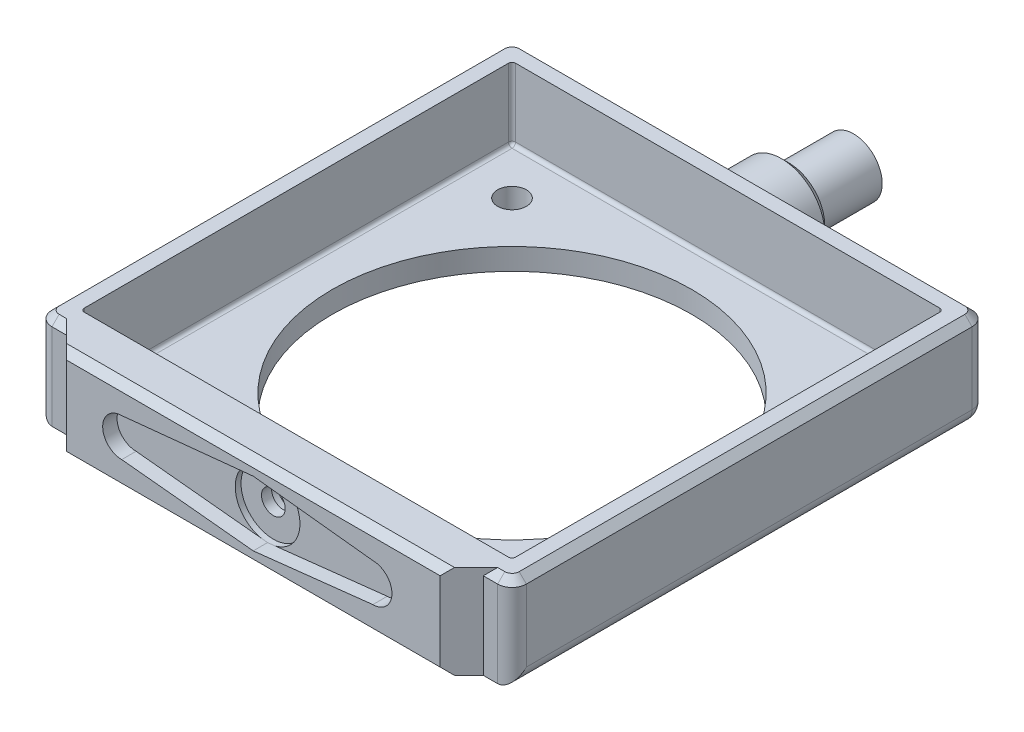
from build123d import *

# Parameters (mm, degrees)
SKETCH1_W                = 66
SKETCH1_H                = 66
SKETCH1_W_2              = 60
SKETCH1_H_2              = 60
BOSS_EXTRUDE1_DEPTH      = 13
SKETCH2_W                = 60
SKETCH2_H                = 60
SKETCH2_R                = 25
SKETCH2_R_2              = 2
BOSS_EXTRUDE2_DEPTH      = 3
FILLET1_R                = 0.5
FILLET2_R                = 2
SKETCH12_W               = 52
SKETCH12_H               = 11
BOSS_EXTRUDE3_DEPTH      = 3
CHAMFER1_SIZE            = 3
CUT_EXTRUDE4_DEPTH       = 12
CUT_EXTRUDE4_DEPTH_BACK  = 12
SKETCH10_R               = 1.65
SKETCH13_R               = 3.05
CUT_EXTRUDE6_DEPTH       = 1.8
SKETCH14_R               = 4
BOSS_EXTRUDE4_DEPTH      = 14.5
BOSS_EXTRUDE5_DEPTH      = 5.5
BOSS_EXTRUDE5_DEPTH_BACK = 2
SKETCH15_R               = 6
CHAMFER2_SIZE            = 1
CHAMFER3_SIZE            = 1
SKETCH17_R               = 2.65
SKETCH17_R_2             = 1.65
CUT_EXTRUDE8_DEPTH       = 2
SKETCH18_R               = 4.5
CUT_EXTRUDE9_DEPTH       = 0.8


with BuildPart() as part:
    # Sketch1 → Boss-Extrude1 (new body)
    with BuildSketch(Plane(origin=(0, 0, 0), x_dir=(1, 0, 0), z_dir=(0, 1, 0))):
        Rectangle(SKETCH1_W, SKETCH1_H)
        Rectangle(SKETCH1_W_2, SKETCH1_H_2, mode=Mode.SUBTRACT)
    extrude(amount=BOSS_EXTRUDE1_DEPTH)

    # Sketch2 → Boss-Extrude2 (add)
    with BuildSketch(Plane(origin=(0, 0, 0), x_dir=(1, 0, 0), z_dir=(0, 1, 0))):
        Rectangle(SKETCH2_W, SKETCH2_H)
        with Locations(Location((0, 0, 0), (0, 0, 270))):
            Circle(SKETCH2_R, mode=Mode.SUBTRACT)
        with Locations(Location((-23.5, 23.5, 0), (0, 0, 270))):
            Circle(SKETCH2_R_2, mode=Mode.SUBTRACT)
        with Locations(Location((23.5, 23.5, 0), (0, 0, 270))):
            Circle(SKETCH2_R_2, mode=Mode.SUBTRACT)
        with Locations(Location((23.5, -23.5, 0), (0, 0, 270))):
            Circle(SKETCH2_R_2, mode=Mode.SUBTRACT)
        with Locations(Location((-23.5, -23.5, 0), (0, 0, 270))):
            Circle(SKETCH2_R_2, mode=Mode.SUBTRACT)
    extrude(amount=BOSS_EXTRUDE2_DEPTH)

    # Fillet1
    fillet1_edges = [part.edges().sort_by_distance(p)[0] for p in [
        (-30, 8, -30),
        (-30, 8, 30),
        (30, 8, 30),
        (30, 8, -30),
        (-30, 3, 0),
        (0, 3, 30),
        (30, 3, 0),
        (0, 3, -30),
    ]]
    fillet(fillet1_edges, radius=FILLET1_R)

    # Fillet2
    fillet2_edges = [part.edges().sort_by_distance(p)[0] for p in [
        (0, 0, -33),
        (33, 0, 0),
        (-33, 0, 0),
        (-33, 6.5, -33),
        (33, 6.5, -33),
        (33, 6.5, 33),
        (-33, 6.5, 33),
    ]]
    fillet(fillet2_edges, radius=FILLET2_R)

    # Sketch12 → Boss-Extrude3 (add)
    with BuildSketch(Plane.XY.offset(33)):
        with Locations((0, 6.5)):
            Rectangle(SKETCH12_W, SKETCH12_H)
    extrude(amount=BOSS_EXTRUDE3_DEPTH)

    # Chamfer1
    # the kernel refuses this chamfer: 3 mm, written as the material it adds along each edge
    with BuildSketch(Plane(origin=(26, 1, 33), x_dir=(0, -0.9996219169112968, -0.027495876610586775), z_dir=(-1, 0, 0))) as chamfer1_piece_1_section:
        Polygon((CHAMFER1_SIZE * 0.999621916911, CHAMFER1_SIZE * 0.0274958766106), (-CHAMFER1_SIZE * 0.0274958766106, CHAMFER1_SIZE * 0.999621916911), (0, 0), align=None)
    chamfer1_piece_1 = extrude(amount=52, mode=Mode.PRIVATE)
    chamfer1_piece_1 = split(chamfer1_piece_1, bisect_by=Plane(origin=(0, 0, 34.280814641), z_dir=(0, 1, 0)), keep=Keep.TOP, mode=Mode.PRIVATE)
    chamfer1_piece_1 = split(chamfer1_piece_1, bisect_by=Plane(origin=(0, 0.572987798, 36), z_dir=(0, 0, -1)), keep=Keep.TOP, mode=Mode.PRIVATE)
    add(chamfer1_piece_1)
    with BuildSketch(Plane(origin=(26, 12, 33), x_dir=(0.9996219169112965, 0, -0.02749587661058676), z_dir=(0, -1, 0))) as chamfer1_piece_2_section:
        Polygon((CHAMFER1_SIZE * 0.999621916911, CHAMFER1_SIZE * 0.0274958766106), (-CHAMFER1_SIZE * 0.0274958766106, CHAMFER1_SIZE * 0.999621916911), (0, 0), align=None)
    chamfer1_piece_2 = extrude(amount=11, mode=Mode.PRIVATE)
    chamfer1_piece_2 = split(chamfer1_piece_2, bisect_by=Plane(origin=(26.991212463, 6.5, 36), z_dir=(0, 0, -1)), keep=Keep.TOP, mode=Mode.PRIVATE)
    add(chamfer1_piece_2)
    with BuildSketch(Plane(origin=(-26, 12, 33), x_dir=(0, 0.9996219169112968, -0.02749587661058678), z_dir=(1, 0, 0))) as chamfer1_piece_3_section:
        Polygon((CHAMFER1_SIZE * 0.999621916911, CHAMFER1_SIZE * 0.0274958766106), (-CHAMFER1_SIZE * 0.0274958766106, CHAMFER1_SIZE * 0.999621916911), (0, 0), align=None)
    chamfer1_piece_3 = extrude(amount=52, mode=Mode.PRIVATE)
    chamfer1_piece_3 = split(chamfer1_piece_3, bisect_by=Plane(origin=(0, 13, 34.280814641), z_dir=(0, -1, 0)), keep=Keep.TOP, mode=Mode.PRIVATE)
    chamfer1_piece_3 = split(chamfer1_piece_3, bisect_by=Plane(origin=(0, 12.427012202, 36), z_dir=(0, 0, -1)), keep=Keep.TOP, mode=Mode.PRIVATE)
    add(chamfer1_piece_3)
    with BuildSketch(Plane(origin=(-26, 1, 33), x_dir=(-0.9996219169112965, 0, -0.02749587661058676), z_dir=(0, 1, 0))) as chamfer1_piece_4_section:
        Polygon((CHAMFER1_SIZE * 0.999621916911, CHAMFER1_SIZE * 0.0274958766106), (-CHAMFER1_SIZE * 0.0274958766106, CHAMFER1_SIZE * 0.999621916911), (0, 0), align=None)
    chamfer1_piece_4 = extrude(amount=11, mode=Mode.PRIVATE)
    chamfer1_piece_4 = split(chamfer1_piece_4, bisect_by=Plane(origin=(-26.991212463, 6.5, 36), z_dir=(0, 0, -1)), keep=Keep.TOP, mode=Mode.PRIVATE)
    add(chamfer1_piece_4)
    with BuildSketch(Plane(origin=(26, 12, 33), x_dir=(0.9996219169112965, 0, -0.02749587661058676), z_dir=(0, -1, 0))) as chamfer1_piece_5a_section:
        Polygon((CHAMFER1_SIZE * 0.999621916911, CHAMFER1_SIZE * 0.0274958766106), (-CHAMFER1_SIZE * 0.0274958766106, CHAMFER1_SIZE * 0.999621916911), (0, 0), align=None)
    chamfer1_piece_5a = extrude(amount=18.715048964, mode=Mode.PRIVATE)
    chamfer1_piece_5a = split(chamfer1_piece_5a, bisect_by=Plane(origin=(26.991212463, 0, 33.985903001), z_dir=(0, 1, 0)), keep=Keep.TOP, mode=Mode.PRIVATE)
    chamfer1_piece_5a = split(chamfer1_piece_5a, bisect_by=Plane(origin=(26.991212463, 1, 33.985903001), z_dir=(0, -1, 0)), keep=Keep.TOP, mode=Mode.PRIVATE)
    chamfer1_piece_5a = split(chamfer1_piece_5a, bisect_by=Plane(origin=(26.991212463, 0.5, 36), z_dir=(0, 0, -1)), keep=Keep.TOP, mode=Mode.PRIVATE)
    with BuildSketch(Plane(origin=(33.715048964, 1, 33), x_dir=(0, -0.9996219169112968, -0.027495876610586775), z_dir=(-1, 0, 0))) as chamfer1_piece_5b_section:
        Polygon((CHAMFER1_SIZE * 0.999621916911, CHAMFER1_SIZE * 0.0274958766106), (-CHAMFER1_SIZE * 0.0274958766106, CHAMFER1_SIZE * 0.999621916911), (0, 0), align=None)
    chamfer1_piece_5b = extrude(amount=59.715048964, mode=Mode.PRIVATE)
    chamfer1_piece_5b = split(chamfer1_piece_5b, bisect_by=Plane(origin=(29.857524482, 0, 34.280814641), z_dir=(0, 1, 0)), keep=Keep.TOP, mode=Mode.PRIVATE)
    chamfer1_piece_5b = split(chamfer1_piece_5b, bisect_by=Plane(origin=(26, 0.572987798, 34.280814641), z_dir=(1, 0, 0)), keep=Keep.TOP, mode=Mode.PRIVATE)
    chamfer1_piece_5b = split(chamfer1_piece_5b, bisect_by=Plane(origin=(29.857524482, 0.572987798, 36), z_dir=(0, 0, -1)), keep=Keep.TOP, mode=Mode.PRIVATE)
    chamfer1_piece_5 = chamfer1_piece_5a & chamfer1_piece_5b
    add(chamfer1_piece_5)
    with BuildSketch(Plane(origin=(26, 1, 33), x_dir=(0, -0.9996219169112968, -0.027495876610586775), z_dir=(-1, 0, 0))) as chamfer1_piece_6a_section:
        Polygon((CHAMFER1_SIZE * 0.999621916911, CHAMFER1_SIZE * 0.0274958766106), (-CHAMFER1_SIZE * 0.0274958766106, CHAMFER1_SIZE * 0.999621916911), (0, 0), align=None)
    chamfer1_piece_6a = extrude(amount=59.715048964, mode=Mode.PRIVATE)
    chamfer1_piece_6a = split(chamfer1_piece_6a, bisect_by=Plane(origin=(-29.857524482, 0, 34.280814641), z_dir=(0, 1, 0)), keep=Keep.TOP, mode=Mode.PRIVATE)
    chamfer1_piece_6a = split(chamfer1_piece_6a, bisect_by=Plane(origin=(-26, 0.572987798, 34.280814641), z_dir=(-1, 0, 0)), keep=Keep.TOP, mode=Mode.PRIVATE)
    chamfer1_piece_6a = split(chamfer1_piece_6a, bisect_by=Plane(origin=(-29.857524482, 0.572987798, 36), z_dir=(0, 0, -1)), keep=Keep.TOP, mode=Mode.PRIVATE)
    with BuildSketch(Plane(origin=(-26, -6.715048964, 33), x_dir=(-0.9996219169112965, 0, -0.02749587661058676), z_dir=(0, 1, 0))) as chamfer1_piece_6b_section:
        Polygon((CHAMFER1_SIZE * 0.999621916911, CHAMFER1_SIZE * 0.0274958766106), (-CHAMFER1_SIZE * 0.0274958766106, CHAMFER1_SIZE * 0.999621916911), (0, 0), align=None)
    chamfer1_piece_6b = extrude(amount=18.715048964, mode=Mode.PRIVATE)
    chamfer1_piece_6b = split(chamfer1_piece_6b, bisect_by=Plane(origin=(-26.991212463, 0, 33.985903001), z_dir=(0, 1, 0)), keep=Keep.TOP, mode=Mode.PRIVATE)
    chamfer1_piece_6b = split(chamfer1_piece_6b, bisect_by=Plane(origin=(-26.991212463, 1, 33.985903001), z_dir=(0, -1, 0)), keep=Keep.TOP, mode=Mode.PRIVATE)
    chamfer1_piece_6b = split(chamfer1_piece_6b, bisect_by=Plane(origin=(-26.991212463, 0.5, 36), z_dir=(0, 0, -1)), keep=Keep.TOP, mode=Mode.PRIVATE)
    chamfer1_piece_6 = chamfer1_piece_6a & chamfer1_piece_6b
    add(chamfer1_piece_6)
    with BuildSketch(Plane(origin=(-26, 12, 33), x_dir=(0, 0.9996219169112968, -0.02749587661058678), z_dir=(1, 0, 0))) as chamfer1_piece_7a_section:
        Polygon((CHAMFER1_SIZE * 0.999621916911, CHAMFER1_SIZE * 0.0274958766106), (-CHAMFER1_SIZE * 0.0274958766106, CHAMFER1_SIZE * 0.999621916911), (0, 0), align=None)
    chamfer1_piece_7a = extrude(amount=59.715048964, mode=Mode.PRIVATE)
    chamfer1_piece_7a = split(chamfer1_piece_7a, bisect_by=Plane(origin=(29.857524482, 13, 34.280814641), z_dir=(0, -1, 0)), keep=Keep.TOP, mode=Mode.PRIVATE)
    chamfer1_piece_7a = split(chamfer1_piece_7a, bisect_by=Plane(origin=(26, 12.427012202, 34.280814641), z_dir=(1, 0, 0)), keep=Keep.TOP, mode=Mode.PRIVATE)
    chamfer1_piece_7a = split(chamfer1_piece_7a, bisect_by=Plane(origin=(29.857524482, 12.427012202, 36), z_dir=(0, 0, -1)), keep=Keep.TOP, mode=Mode.PRIVATE)
    with BuildSketch(Plane(origin=(26, 19.715048964, 33), x_dir=(0.9996219169112965, 0, -0.02749587661058676), z_dir=(0, -1, 0))) as chamfer1_piece_7b_section:
        Polygon((CHAMFER1_SIZE * 0.999621916911, CHAMFER1_SIZE * 0.0274958766106), (-CHAMFER1_SIZE * 0.0274958766106, CHAMFER1_SIZE * 0.999621916911), (0, 0), align=None)
    chamfer1_piece_7b = extrude(amount=18.715048964, mode=Mode.PRIVATE)
    chamfer1_piece_7b = split(chamfer1_piece_7b, bisect_by=Plane(origin=(26.991212463, 13, 33.985903001), z_dir=(0, -1, 0)), keep=Keep.TOP, mode=Mode.PRIVATE)
    chamfer1_piece_7b = split(chamfer1_piece_7b, bisect_by=Plane(origin=(26.991212463, 12, 33.985903001), z_dir=(0, 1, 0)), keep=Keep.TOP, mode=Mode.PRIVATE)
    chamfer1_piece_7b = split(chamfer1_piece_7b, bisect_by=Plane(origin=(26.991212463, 12.5, 36), z_dir=(0, 0, -1)), keep=Keep.TOP, mode=Mode.PRIVATE)
    chamfer1_piece_7 = chamfer1_piece_7a & chamfer1_piece_7b
    add(chamfer1_piece_7)
    with BuildSketch(Plane(origin=(-33.715048964, 12, 33), x_dir=(0, 0.9996219169112968, -0.02749587661058678), z_dir=(1, 0, 0))) as chamfer1_piece_8a_section:
        Polygon((CHAMFER1_SIZE * 0.999621916911, CHAMFER1_SIZE * 0.0274958766106), (-CHAMFER1_SIZE * 0.0274958766106, CHAMFER1_SIZE * 0.999621916911), (0, 0), align=None)
    chamfer1_piece_8a = extrude(amount=59.715048964, mode=Mode.PRIVATE)
    chamfer1_piece_8a = split(chamfer1_piece_8a, bisect_by=Plane(origin=(-29.857524482, 13, 34.280814641), z_dir=(0, -1, 0)), keep=Keep.TOP, mode=Mode.PRIVATE)
    chamfer1_piece_8a = split(chamfer1_piece_8a, bisect_by=Plane(origin=(-26, 12.427012202, 34.280814641), z_dir=(-1, 0, 0)), keep=Keep.TOP, mode=Mode.PRIVATE)
    chamfer1_piece_8a = split(chamfer1_piece_8a, bisect_by=Plane(origin=(-29.857524482, 12.427012202, 36), z_dir=(0, 0, -1)), keep=Keep.TOP, mode=Mode.PRIVATE)
    with BuildSketch(Plane(origin=(-26, 1, 33), x_dir=(-0.9996219169112965, 0, -0.02749587661058676), z_dir=(0, 1, 0))) as chamfer1_piece_8b_section:
        Polygon((CHAMFER1_SIZE * 0.999621916911, CHAMFER1_SIZE * 0.0274958766106), (-CHAMFER1_SIZE * 0.0274958766106, CHAMFER1_SIZE * 0.999621916911), (0, 0), align=None)
    chamfer1_piece_8b = extrude(amount=18.715048964, mode=Mode.PRIVATE)
    chamfer1_piece_8b = split(chamfer1_piece_8b, bisect_by=Plane(origin=(-26.991212463, 13, 33.985903001), z_dir=(0, -1, 0)), keep=Keep.TOP, mode=Mode.PRIVATE)
    chamfer1_piece_8b = split(chamfer1_piece_8b, bisect_by=Plane(origin=(-26.991212463, 12, 33.985903001), z_dir=(0, 1, 0)), keep=Keep.TOP, mode=Mode.PRIVATE)
    chamfer1_piece_8b = split(chamfer1_piece_8b, bisect_by=Plane(origin=(-26.991212463, 12.5, 36), z_dir=(0, 0, -1)), keep=Keep.TOP, mode=Mode.PRIVATE)
    chamfer1_piece_8 = chamfer1_piece_8a & chamfer1_piece_8b
    add(chamfer1_piece_8)

    # Sketch10 → Cut-Extrude4 (cut, two sides: drawn at the far end of the back side and taken through both)
    with BuildSketch(Plane.XY.offset(33).offset(-CUT_EXTRUDE4_DEPTH_BACK)):
        with Locations(Location((0, 6.5, 0), (0, 0, 180))):
            Circle(SKETCH10_R)
    extrude(amount=CUT_EXTRUDE4_DEPTH + CUT_EXTRUDE4_DEPTH_BACK, mode=Mode.SUBTRACT)

    # Sketch13 → Cut-Extrude6 (cut)
    with BuildSketch(Plane(origin=(0, 0, 30), x_dir=(-1, 0, 0), z_dir=(0, 0, -1))):
        with Locations((0, 6.5)):
            Circle(SKETCH13_R)
    extrude(amount=-CUT_EXTRUDE6_DEPTH, mode=Mode.SUBTRACT)

    # Sketch14 → Boss-Extrude4 (add)
    with BuildSketch(Plane(origin=(0, 0, -33), x_dir=(-1, 0, 0), z_dir=(0, 0, -1))):
        with Locations(Location((0, 6.5, 0), (0, 0, 180))):
            Circle(SKETCH14_R)
    extrude(amount=BOSS_EXTRUDE4_DEPTH)

    # Sketch15 → Boss-Extrude5 (add, two sides: drawn at the far end of the back side and taken through both)
    with BuildSketch(Plane(origin=(0, 0, -33), x_dir=(-1, 0, 0), z_dir=(0, 0, -1)).offset(-BOSS_EXTRUDE5_DEPTH_BACK)):
        with Locations((0, 6.5)):
            Circle(SKETCH15_R)
    extrude(amount=BOSS_EXTRUDE5_DEPTH + BOSS_EXTRUDE5_DEPTH_BACK)

    # Chamfer2
    chamfer2_edges = [part.edges().sort_by_distance(p)[0] for p in [
        (6, 6.5, -38.5),
    ]]
    chamfer(chamfer2_edges, length=CHAMFER2_SIZE)

    # Chamfer3
    # the kernel refuses this chamfer: 1 mm, written as the material it takes off along each edge
    with BuildSketch(Plane(origin=(26.428317012, 13, 33), x_dir=(0, 0.027495876610585647, -0.9996219169112968), z_dir=(1, 0, 0))) as chamfer3_piece_1_section:
        Polygon((CHAMFER3_SIZE * 0.999621916911, -CHAMFER3_SIZE * 0.0274958766106), (-CHAMFER3_SIZE * 0.0274958766106, -CHAMFER3_SIZE * 0.999621916911), (0, 0), align=None)
    chamfer3_piece_1 = extrude(amount=4.571682988, mode=Mode.PRIVATE)
    chamfer3_piece_1 = split(chamfer3_piece_1, bisect_by=Plane(origin=(29.718829638, 12.649880303, 32.281170362), z_dir=(0.7071067811868302, 0, 0.7071067811862648)), keep=Keep.TOP, mode=Mode.PRIVATE)
    add(chamfer3_piece_1, mode=Mode.SUBTRACT)
    with BuildSketch(Plane(origin=(-33, 13, -31), x_dir=(0.9996219169112968, 0.027495876610585647, 0), z_dir=(0, 0, 1)), Plane(origin=(33, 13, 31), x_dir=(-0.9996219169112968, 0.027495876610585647, 0), z_dir=(0, 0, -1))) as chamfer3_piece_2:
        Polygon((CHAMFER3_SIZE * 0.999621916911, -CHAMFER3_SIZE * 0.0274958766106), (-CHAMFER3_SIZE * 0.0274958766106, -CHAMFER3_SIZE * 0.999621916911), (0, 0), align=None)
    extrude(amount=62, mode=Mode.SUBTRACT)
    with BuildSketch(Plane(origin=(31, 13, -33), x_dir=(0, -0.9996219169112968, -0.0274958766105891), z_dir=(-1, 0, 0))) as chamfer3_piece_3_section:
        Polygon((CHAMFER3_SIZE * 0.999621916911, CHAMFER3_SIZE * 0.0274958766106), (-CHAMFER3_SIZE * 0.0274958766106, CHAMFER3_SIZE * 0.999621916911), (0, 0), align=None)
    chamfer3_piece_3 = extrude(amount=62, mode=Mode.PRIVATE)
    chamfer3_piece_3 = chamfer3_piece_3 - Plane(origin=(0, 6.5, -32.667817894), x_dir=(-1, 0, 0), z_dir=(0, 0, 1)) * Cylinder(6, 128, mode=Mode.PRIVATE)
    add(chamfer3_piece_3, mode=Mode.SUBTRACT)
    with BuildSketch(Plane(origin=(-31, 13, 33), x_dir=(0, 0.027495876610585647, -0.9996219169112968), z_dir=(1, 0, 0))) as chamfer3_piece_4_section:
        Polygon((CHAMFER3_SIZE * 0.999621916911, -CHAMFER3_SIZE * 0.0274958766106), (-CHAMFER3_SIZE * 0.0274958766106, -CHAMFER3_SIZE * 0.999621916911), (0, 0), align=None)
    chamfer3_piece_4 = extrude(amount=4.571682988, mode=Mode.PRIVATE)
    chamfer3_piece_4 = split(chamfer3_piece_4, bisect_by=Plane(origin=(-29.718829638, 12.649880303, 32.281170362), z_dir=(-0.7071067811868302, 0, 0.7071067811862648)), keep=Keep.TOP, mode=Mode.PRIVATE)
    add(chamfer3_piece_4, mode=Mode.SUBTRACT)
    with BuildSketch(Plane(origin=(31, 13, -31), x_dir=(1, 0, 0), z_dir=(0, 0, 1))) as chamfer3_piece_5:
        Polygon((2, -CHAMFER3_SIZE), (2 - CHAMFER3_SIZE, 0), (2, 0), align=None)
    revolve(axis=Axis((31, 13, -31), (0, 1, 0)), revolution_arc=90, mode=Mode.SUBTRACT)
    with BuildSketch(Plane(origin=(31, 13, 31), x_dir=(0, 0, 1), z_dir=(-1, 0, 0))) as chamfer3_piece_6:
        Polygon((2 - CHAMFER3_SIZE, 0), (2, -CHAMFER3_SIZE), (2, 0), align=None)
    revolve(axis=Axis((31, 13, 31), (0, 1, 0)), revolution_arc=90, mode=Mode.SUBTRACT)
    with BuildSketch(Plane(origin=(-31, 13, 31), x_dir=(0, 0, 1), z_dir=(1, 0, 0))) as chamfer3_piece_7:
        Polygon((2 - CHAMFER3_SIZE, 0), (2, CHAMFER3_SIZE), (2, 0), align=None)
    revolve(axis=Axis((-31, 13, 31), (0, -1, 0)), revolution_arc=90, mode=Mode.SUBTRACT)
    with BuildSketch(Plane(origin=(-31, 13, -31), x_dir=(0, 0, -1), z_dir=(1, 0, 0))) as chamfer3_piece_8:
        Polygon((2, -CHAMFER3_SIZE), (2 - CHAMFER3_SIZE, 0), (2, 0), align=None)
    revolve(axis=Axis((-31, 13, -31), (0, 1, 0)), revolution_arc=90, mode=Mode.SUBTRACT)

    # Sketch17 → Cut-Extrude8 (cut)
    # profile 1 of 5: a face of its own
    with BuildSketch(Plane.XY.offset(36)):
        with Locations((-18.293581625, 6.5)):
            Circle(SKETCH17_R)
    # profile 2 of 5: a face of its own
    with BuildSketch(Plane.XY.offset(36)):
        with BuildLine():
            Line((-0.900941406, 10.908889269), (-18.293581625, 9.15))
            ThreePointArc((-18.293581625, 9.15), (-16.419748655, 8.37383297), (-15.643581625, 6.5))
            ThreePointArc((-15.643581625, 6.5), (-16.419748655, 4.62616703), (-18.293581625, 3.85))
            Line((-18.293581625, 3.85), (-0.900941406, 2.091110731))
            ThreePointArc((-0.900941406, 2.091110731), (-4.5, 6.5), (-0.900941406, 10.908889269))
        make_face()
    # profile 3 of 5: a face of its own
    with BuildSketch(Plane.XY.offset(36)):
        with BuildLine():
            Line((0, 11), (-0.900941406, 10.908889269))
            ThreePointArc((-0.900941406, 10.908889269), (-4.5, 6.5), (-0.900941406, 2.091110731))
            Line((-0.900941406, 2.091110731), (0, 2))
            Line((0, 2), (0.98815335, 2.109834518))
            ThreePointArc((0.98815335, 2.109834518), (3.514021206, 3.689011746), (4.5, 6.5))
            ThreePointArc((4.5, 6.5), (3.514021206, 9.310988254), (0.98815335, 10.890165482))
            Line((0.98815335, 10.890165482), (0, 11))
        make_face()
        with Locations(Location((0, 6.5, 0), (0, 0, 180))):
            Circle(SKETCH17_R_2, mode=Mode.SUBTRACT)
    # profile 4 of 5: a face of its own
    with BuildSketch(Plane.XY.offset(36)):
        with BuildLine():
            Line((16.643981564, 9.15), (0.98815335, 10.890165482))
            ThreePointArc((0.98815335, 10.890165482), (3.514021206, 9.310988254), (4.5, 6.5))
            ThreePointArc((4.5, 6.5), (3.514021206, 3.689011746), (0.98815335, 2.109834518))
            Line((0.98815335, 2.109834518), (16.643981564, 3.85))
            ThreePointArc((16.643981564, 3.85), (13.993981564, 6.5), (16.643981564, 9.15))
        make_face()
    # profile 5 of 5: a face of its own
    with BuildSketch(Plane.XY.offset(36)):
        with Locations((16.643981564, 6.5)):
            Circle(SKETCH17_R)
    extrude(amount=-CUT_EXTRUDE8_DEPTH, mode=Mode.SUBTRACT)

    # Sketch18 → Cut-Extrude9 (cut)
    with BuildSketch(Plane.XY.offset(34)):
        with Locations((0, 6.5)):
            Circle(SKETCH18_R)
    extrude(amount=-CUT_EXTRUDE9_DEPTH, mode=Mode.SUBTRACT)


solid = part.part
